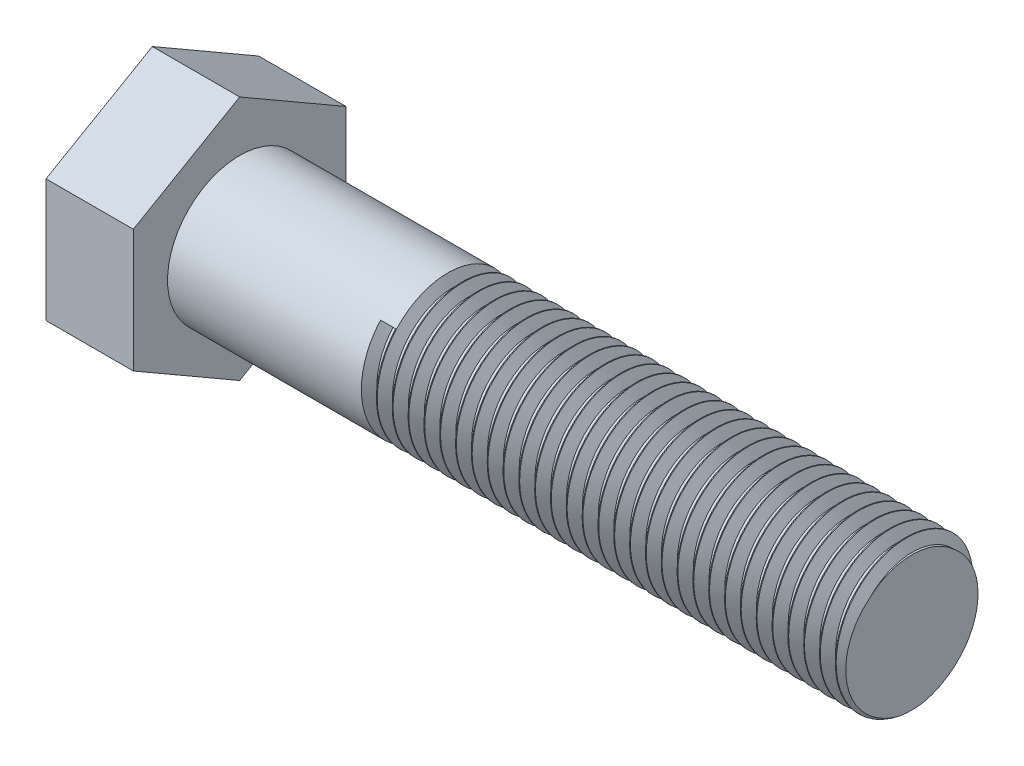
from build123d import *

# Parameters (mm, degrees)
BOSS_EXTRUDE1_DEPTH = 5.842
SKETCH2_R           = 4.826
BOSS_EXTRUDE2_DEPTH = 44.958
CUT_SWEEP1_PITCH    = 1.058333333


with BuildPart() as part:
    # Sketch1 → Boss-Extrude1 (new body)
    with BuildSketch(Plane(origin=(0, 0, 0), x_dir=(0, 0, -1), z_dir=(1, 0, 0))):
        Polygon((0, -8.212230229), (7.112, -4.106115114), (7.112, 4.106115114), (0, 8.212230229), (-7.112, 4.106115114), (-7.112, -4.106115114), align=None)
    extrude(amount=-BOSS_EXTRUDE1_DEPTH)

    # Sketch2 → Boss-Extrude2 (add)
    with BuildSketch(Plane(origin=(0, 0, 0), x_dir=(0, 0, -1), z_dir=(1, 0, 0))):
        Circle(SKETCH2_R)
    extrude(amount=BOSS_EXTRUDE2_DEPTH)

    # Cut-Sweep1: arcs per turn and ends read off the stored shape
    # Cut-Sweep1: the profile of Sketch7 profile screwed along a right-hand helix through 31 turns, 8 arcs to a turn; built about Z, then put on its axis
    cut_sweep1_z = Axis((0, 0, 0), (0, 0, 1))
    cut_sweep1_corners = [(4.826300242, 0, -0.688035556), (4.826300242, 0, -1.693214444), (4.175760242, 0, -1.317625), (4.175760242, 0, -1.063625)]
    with BuildLine(mode=Mode.PRIVATE) as cut_sweep1_profile:
        Line(cut_sweep1_corners[0], cut_sweep1_corners[1])
        Line(cut_sweep1_corners[1], cut_sweep1_corners[2])
        Line(cut_sweep1_corners[2], cut_sweep1_corners[3])
        Line(cut_sweep1_corners[3], cut_sweep1_corners[0])
    cut_sweep1_cap = Face(cut_sweep1_profile.wire())
    cut_sweep1_turn_angles = [0, 22.5, 45, 67.5, 90, 112.5, 135, 157.5, 180, 202.5, 225, 247.5, 270, 292.5, 315, 337.5, 360]
    cut_sweep1_turn_weights = [1, 0.9238795325112867, 1, 0.9238795325112867, 1, 0.9238795325112867, 1, 0.9238795325112867, 1, 0.9238795325112867, 1, 0.9238795325112867, 1, 0.9238795325112867, 1, 0.9238795325112867, 1]
    cut_sweep1_turn_rails = [Edge.make_bspline([Vector(p[0], p[1], 0).rotate(cut_sweep1_z, cut_sweep1_turn_angles[k]) / cut_sweep1_turn_weights[k] + Vector(0, 0, p[2] + CUT_SWEEP1_PITCH * cut_sweep1_turn_angles[k] / 360) for k in range(17)], [0, 0, 0, 1, 1, 2, 2, 3, 3, 4, 4, 5, 5, 6, 6, 7, 7, 8, 8, 8], 2, cut_sweep1_turn_weights) for p in cut_sweep1_corners]
    cut_sweep1_turn_sides = [Face.make_surface_from_curves(cut_sweep1_turn_rails[p[0]], cut_sweep1_turn_rails[p[1]]) for p in [(0, 1), (1, 2), (2, 3), (3, 0)]]
    cut_sweep1 = Plane(origin=(44.958, 0, 0), x_dir=(0, 0.7071067811865438, 0.7071067811865512), z_dir=(-1, 0, 0)) * Solid(Shell([*[p.moved(Location((0, 0, CUT_SWEEP1_PITCH * i))) for i in range(31) for p in cut_sweep1_turn_sides], cut_sweep1_cap, cut_sweep1_cap.rotate(cut_sweep1_z, 11160).moved(Location((0, 0, CUT_SWEEP1_PITCH * 11160 / 360)))]))
    add(cut_sweep1, mode=Mode.SUBTRACT)


solid = part.part
